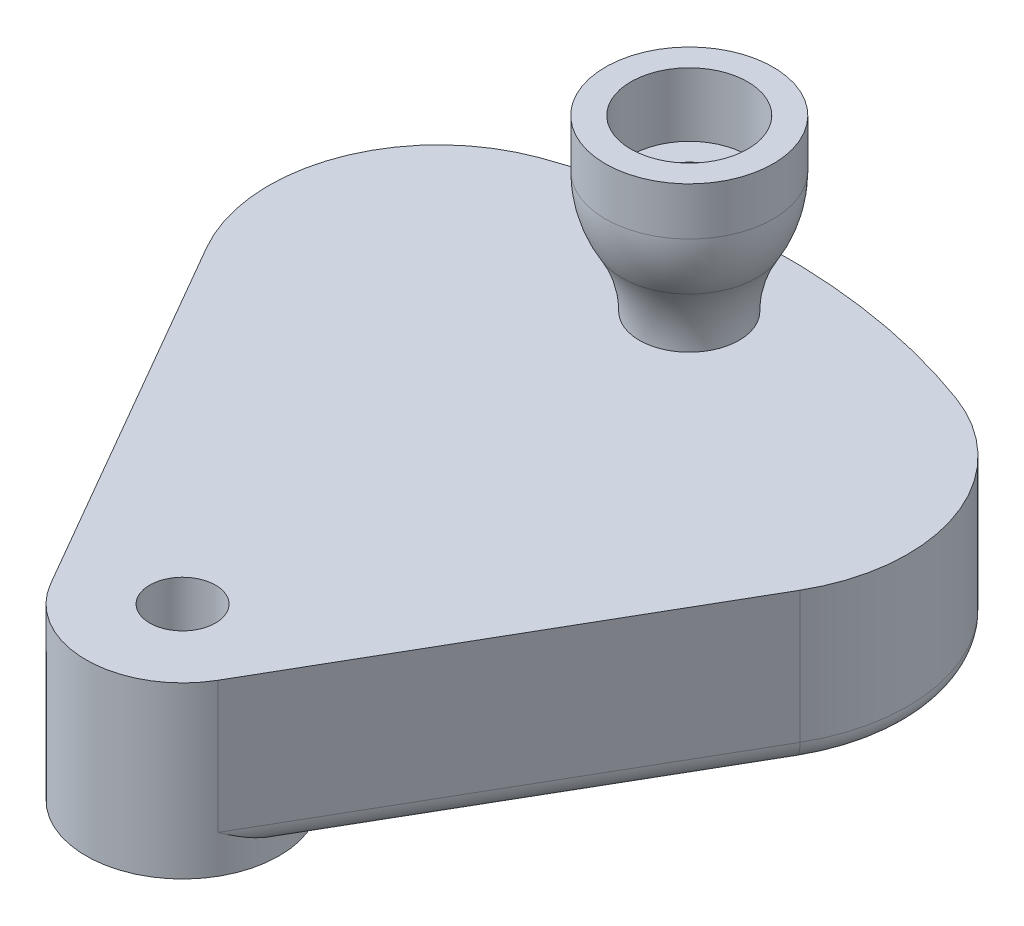
from build123d import *

# Parameters (mm, degrees)
SKETCH1_R           = 1.55
BOSS_EXTRUDE1_DEPTH = 8
FILLET1_R           = 8
CHAMFER1_SIZE       = 1.091910703
CHAMFER1_SIZE_2     = 3
BOSS_EXTRUDE2_START = -8
SKETCH2_R           = 4.55
SKETCH2_R_2         = 1.55
BOSS_EXTRUDE2_DEPTH = 8
FILLET2_R           = 1
SKETCH3_R           = 1.25
CUT_EXTRUDE1_DEPTH  = 34.093285996


with BuildPart() as part:
    # Sketch1 → Boss-Extrude1 (new body)
    with BuildSketch(Plane(origin=(0, 0, 0), x_dir=(1, 0, 0), z_dir=(0, 1, 0))):
        with BuildLine():
            Line((-17.940415587, 21.973711306), (-3.940415587, -2.275))
            ThreePointArc((-3.940415587, -2.275), (0, -4.55), (3.940415587, -2.275))
            Line((3.940415587, -2.275), (17.940415587, 21.973711306))
            ThreePointArc((17.940415587, 21.973711306), (0, 28.367278685), (-17.940415587, 21.973711306))
        make_face()
        with Locations(Location((0, 0, 0), (0, 0, 270))):
            Circle(SKETCH1_R, mode=Mode.SUBTRACT)
    extrude(amount=BOSS_EXTRUDE1_DEPTH)

    # Fillet1
    fillet1_edges = [part.edges().sort_by_distance(p)[0] for p in [
        (17.940415587, 4, -21.973711306),
        (-17.940415587, 4, -21.973711306),
    ]]
    fillet(fillet1_edges, radius=FILLET1_R)

    # Chamfer1
    # the kernel refuses this chamfer: 3, 1.091910703 mm, written as the material it takes off along each edge
    with BuildSketch(Plane(origin=(-13.976893319, 0, -15.10868936), x_dir=(-0.08577193736400629, 0.9950833631817486, 0.04952045112602449), z_dir=(0.49999999999999806, 0, 0.8660254037844399))) as chamfer1_piece_1:
        Polygon((CHAMFER1_SIZE * 0.995083362998, -CHAMFER1_SIZE * 0.0990409022338), (-CHAMFER1_SIZE_2 * 0.099040902252, -CHAMFER1_SIZE_2 * 0.995083363182), (0, 0), align=None)
    extrude(amount=20.072955463, mode=Mode.SUBTRACT)
    with BuildSketch(Plane(origin=(0, 0, 0), x_dir=(0.3460791300418841, 0, -0.9382053270736915), z_dir=(0.9382053270736915, 0, 0.3460791300418841))) as chamfer1_piece_2:
        Polygon((28.367278685 - CHAMFER1_SIZE_2, 0), (28.367278685, CHAMFER1_SIZE), (28.367278685, 0), align=None)
    revolve(axis=Axis((0, 0, 0), (0, 1, 0)), revolution_arc=40.495367591, mode=Mode.SUBTRACT)
    with BuildSketch(Plane(origin=(7.048690089, 0, -19.10868936), x_dir=(0.86602540378444, 0, 0.4999999999999976), z_dir=(-0.4999999999999976, 0, 0.86602540378444))) as chamfer1_piece_3:
        Polygon((8 - CHAMFER1_SIZE_2, 0), (8, CHAMFER1_SIZE), (8, 0), align=None)
    revolve(axis=Axis((7.048690089, 0, -19.10868936), (0, 1, 0)), revolution_arc=99.752316204, mode=Mode.SUBTRACT)
    with BuildSketch(Plane(origin=(-7.048690089, 0, -19.10868936), x_dir=(-0.8660254037844399, 0, 0.499999999999998), z_dir=(0.499999999999998, 0, 0.8660254037844399))) as chamfer1_piece_4:
        Polygon((8 - CHAMFER1_SIZE_2, 0), (8, -CHAMFER1_SIZE), (8, 0), align=None)
    revolve(axis=Axis((-7.048690089, 0, -19.10868936), (0, -1, 0)), revolution_arc=99.752316204, mode=Mode.SUBTRACT)
    with BuildSketch(Plane(origin=(3.940415587, 0, 2.275), x_dir=(-0.8659501345095242, -0.013184058198645904, -0.4999565432638637), z_dir=(0.49999999999999806, 0, -0.8660254037844399))) as chamfer1_piece_5:
        Polygon((CHAMFER1_SIZE_2 * 0.999913086528, CHAMFER1_SIZE_2 * 0.0131840581986), (-CHAMFER1_SIZE * 0.0131840581962, CHAMFER1_SIZE * 0.999913086343), (0, 0), align=None)
    extrude(amount=20.072955463, mode=Mode.SUBTRACT)
    with BuildSketch(Plane(origin=(0, 0, 0), x_dir=(-0.8660254037844397, 0, 0.49999999999999806), z_dir=(-0.49999999999999806, 0, -0.8660254037844397))) as chamfer1_piece_6:
        Polygon((4.55 - CHAMFER1_SIZE_2, 0), (4.55, CHAMFER1_SIZE), (4.55, 0), align=None)
    revolve(axis=Axis((0, 0, 0), (0, 1, 0)), revolution_arc=120, mode=Mode.SUBTRACT)

    # Sketch2 → Boss-Extrude2 (add)
    with BuildSketch(Plane(origin=(0, 8, 0), x_dir=(1, 0, 0), z_dir=(0, 1, 0)).offset(BOSS_EXTRUDE2_START)):
        Circle(SKETCH2_R)
        with Locations(Location((0, 0, 0), (0, 0, 270))):
            Circle(SKETCH2_R_2, mode=Mode.SUBTRACT)
    extrude(amount=BOSS_EXTRUDE2_DEPTH)

    # Fillet2
    # the kernel refuses this fillet: 1 mm, written as the material it takes off along each edge
    with BuildSketch(Plane(origin=(-11.378817108, 0, -16.60868936), x_dir=(0.866025403784329, -5.361374088471519e-13, -0.50000000000019), z_dir=(0.5000000000001901, 0, 0.866025403784329))) as fillet2_piece_1_section:
        with BuildLine():
            CenterArc((FILLET2_R * 0.176326980708, FILLET2_R), FILLET2_R, 250, 20)
            Line((-FILLET2_R * 0.165693162617, FILLET2_R * 0.0603073792139), (0, 0))
            Line((0, 0), (FILLET2_R * 0.176326980708, 0))
        make_face()
    fillet2_piece_1 = extrude(amount=16.235922988, mode=Mode.PRIVATE)
    fillet2_piece_1 = fillet2_piece_1 - Plane(origin=(0, 0.006623758, 0), x_dir=(-0.8660254037844397, 0, 0.49999999999999806), z_dir=(0, -1, 0)) * Cylinder(4.55, 34, mode=Mode.PRIVATE)
    add(fillet2_piece_1, mode=Mode.SUBTRACT)
    with BuildSketch(Plane(origin=(-7.048690089, 0, -19.10868936), x_dir=(-0.8660254037843291, 0, 0.5000000000001897), z_dir=(0.5000000000001897, 0, 0.8660254037843291))) as fillet2_piece_2:
        with BuildLine():
            CenterArc((5 - FILLET2_R * 0.176326980739, -FILLET2_R), FILLET2_R, 69.999999997, 20.000000003)
            Line((5 + FILLET2_R * 0.165693162642, -FILLET2_R * 0.0603073792344), (5, 0))
            Line((5, 0), (5 - FILLET2_R * 0.176326980739, 0))
        make_face()
    revolve(axis=Axis((-7.048690089, 0, -19.10868936), (0, -1, 0)), revolution_arc=99.752316204, mode=Mode.SUBTRACT)
    with BuildSketch(Plane(origin=(0, 0, 0), x_dir=(0.34607913004188606, 0, -0.938205327073691), z_dir=(0.938205327073691, 0, 0.34607913004188606))) as fillet2_piece_3:
        with BuildLine():
            CenterArc((25.367278685 - FILLET2_R * 0.176326980739, FILLET2_R), FILLET2_R, 270, 20.000000003)
            Line((25.367278685 + FILLET2_R * 0.165693162642, FILLET2_R * 0.0603073792344), (25.367278685, 0))
            Line((25.367278685, 0), (25.367278685 - FILLET2_R * 0.176326980739, 0))
        make_face()
    revolve(axis=Axis((0, 0, 0), (0, 1, 0)), revolution_arc=40.495367591, mode=Mode.SUBTRACT)
    with BuildSketch(Plane(origin=(7.048690089, 0, -19.10868936), x_dir=(0.8660254037843291, 0, 0.5000000000001897), z_dir=(-0.5000000000001897, 0, 0.8660254037843291))) as fillet2_piece_4:
        with BuildLine():
            CenterArc((5 - FILLET2_R * 0.176326980739, FILLET2_R), FILLET2_R, 270, 20.000000003)
            Line((5 + FILLET2_R * 0.165693162642, FILLET2_R * 0.0603073792344), (5, 0))
            Line((5, 0), (5 - FILLET2_R * 0.176326980739, 0))
        make_face()
    revolve(axis=Axis((7.048690089, 0, -19.10868936), (0, 1, 0)), revolution_arc=99.752316204, mode=Mode.SUBTRACT)
    with BuildSketch(Plane(origin=(-13.976893319, 1.091910703, -15.10868936), x_dir=(0.8137976813493196, -0.34202014332551345, -0.469846310393161), z_dir=(0.5000000000001901, 0, 0.866025403784329))) as fillet2_piece_5_section:
        with BuildLine():
            CenterArc((FILLET2_R * 0.70020753821, FILLET2_R), FILLET2_R, 200, 70)
            Line((-FILLET2_R * 0.239485082576, FILLET2_R * 0.657979856674), (0, 0))
            Line((0, 0), (FILLET2_R * 0.70020753821, 0))
        make_face()
    fillet2_piece_5 = extrude(amount=21.823474309, mode=Mode.PRIVATE)
    fillet2_piece_5 = fillet2_piece_5 - Plane(origin=(0, 1.202448518, 0), x_dir=(-0.8660254037844397, 0, 0.49999999999999806), z_dir=(0, -1, 0)) * Cylinder(4.55, 47, mode=Mode.PRIVATE)
    add(fillet2_piece_5, mode=Mode.SUBTRACT)
    with BuildSketch(Plane(origin=(-7.048690089, 1.091910703, -19.10868936), x_dir=(-0.8660254037843289, 0, 0.5000000000001901), z_dir=(0.5000000000001901, 0, 0.8660254037843289))) as fillet2_piece_6:
        with BuildLine():
            CenterArc((8 - FILLET2_R, -FILLET2_R * 0.700207538166), FILLET2_R, 0, 69.999999997)
            Line((8, -FILLET2_R * 0.700207538166), (8, 0))
            Line((8, 0), (8 - FILLET2_R * 0.657979856619, FILLET2_R * 0.2394850826))
        make_face()
    revolve(axis=Axis((-7.048690089, 1.091910703, -19.10868936), (0, -1, 0)), revolution_arc=99.752316204, mode=Mode.SUBTRACT)
    with BuildSketch(Plane(origin=(0, 1.091910703, 0), x_dir=(0.34607913004188606, 0, -0.9382053270736909), z_dir=(0.9382053270736909, 0, 0.34607913004188606))) as fillet2_piece_7:
        with BuildLine():
            CenterArc((28.367278685 - FILLET2_R, FILLET2_R * 0.700207538166), FILLET2_R, 290.000000003, 69.999999997)
            Line((28.367278685, FILLET2_R * 0.700207538166), (28.367278685, 0))
            Line((28.367278685, 0), (28.367278685 - FILLET2_R * 0.657979856619, -FILLET2_R * 0.2394850826))
        make_face()
    revolve(axis=Axis((0, 1.091910703, 0), (0, 1, 0)), revolution_arc=40.495367591, mode=Mode.SUBTRACT)
    with BuildSketch(Plane(origin=(7.048690089, 1.091910703, -19.10868936), x_dir=(0.8660254037843289, 0, 0.5000000000001901), z_dir=(-0.5000000000001901, 0, 0.8660254037843289))) as fillet2_piece_8:
        with BuildLine():
            CenterArc((8 - FILLET2_R, FILLET2_R * 0.700207538166), FILLET2_R, 290.000000003, 69.999999997)
            Line((8, FILLET2_R * 0.700207538166), (8, 0))
            Line((8, 0), (8 - FILLET2_R * 0.657979856619, -FILLET2_R * 0.2394850826))
        make_face()
    revolve(axis=Axis((7.048690089, 1.091910703, -19.10868936), (0, 1, 0)), revolution_arc=99.752316204, mode=Mode.SUBTRACT)
    with BuildSketch(Plane(origin=(3.260855614, 0, -2.547967599), x_dir=(-0.8660254037843289, 0, -0.50000000000019), z_dir=(0.5000000000001901, 0, -0.866025403784329))) as fillet2_piece_9_section:
        with BuildLine():
            CenterArc((FILLET2_R * 0.176326980709, FILLET2_R), FILLET2_R, 250, 20)
            Line((-FILLET2_R * 0.165693162617, FILLET2_R * 0.0603073792142), (0, 0))
            Line((0, 0), (FILLET2_R * 0.176326980709, 0))
        make_face()
    fillet2_piece_9 = extrude(amount=16.235922988, mode=Mode.PRIVATE)
    fillet2_piece_9 = fillet2_piece_9 - Plane(origin=(0, 0.006623758, 0), x_dir=(-0.8660254037844397, 0, 0.49999999999999806), z_dir=(0, -1, 0)) * Cylinder(4.55, 34, mode=Mode.PRIVATE)
    add(fillet2_piece_9, mode=Mode.SUBTRACT)
    with BuildSketch(Plane(origin=(3.065156164, 1.091910703, 3.79099379), x_dir=(-0.813797681349209, -0.34202014332586417, -0.46984631039309716), z_dir=(0.5000000000001901, 0, -0.866025403784329))) as fillet2_piece_10_section:
        with BuildLine():
            CenterArc((FILLET2_R * 0.70020753821, FILLET2_R), FILLET2_R, 200, 70)
            Line((-FILLET2_R * 0.239485082576, FILLET2_R * 0.657979856674), (0, 0))
            Line((0, 0), (FILLET2_R * 0.70020753821, 0))
        make_face()
    fillet2_piece_10 = extrude(amount=21.823474309, mode=Mode.PRIVATE)
    fillet2_piece_10 = fillet2_piece_10 - Plane(origin=(0, 1.202094614, 0), x_dir=(-0.8660254037844397, 0, 0.49999999999999806), z_dir=(0, -1, 0)) * Cylinder(4.55, 47, mode=Mode.PRIVATE)
    add(fillet2_piece_10, mode=Mode.SUBTRACT)

    # Sketch3 → Cut-Extrude1 (cut, through all)
    with BuildSketch(Plane(origin=(0, 8, 0), x_dir=(1, 0, 0), z_dir=(0, 1, 0))):
        with Locations(Location((0, 23.867278685, 0), (0, 0, 270))):
            Circle(SKETCH3_R)
    extrude(amount=-CUT_EXTRUDE1_DEPTH, mode=Mode.SUBTRACT)


with BuildPart() as body_2:
    # Sketch4 → Revolve1 (revolve)
    with BuildSketch(Plane(origin=(0, 0, 0), x_dir=(0, 0, -1), z_dir=(1, 0, 0)), mode=Mode.PRIVATE) as revolve1_sk:
        with BuildLine():
            Line((25.417278685, 8), (26.217278685, 8))
            ThreePointArc((26.217278685, 8), (26.426733202, 9.533798037), (27.03975876, 10.955278701))
            ThreePointArc((27.03975876, 10.955278701), (27.619273815, 12.299055375), (27.817278685, 13.749009692))
            Line((27.817278685, 13.749009692), (27.817278685, 16))
            Line((27.817278685, 16), (26.617278685, 16))
            Line((26.617278685, 16), (26.617278685, 13))
            Line((26.617278685, 13), (25.417278685, 13))
            Line((25.417278685, 13), (25.417278685, 8))
        make_face()
    revolve(revolve1_sk.sketch.rotate(Axis((0, 15.487614556, -23.867278685), (0, -1, 0)), 180), axis=Axis((0, 15.487614556, -23.867278685), (0, -1, 0)))


solid = Compound([part.part, body_2.part])
